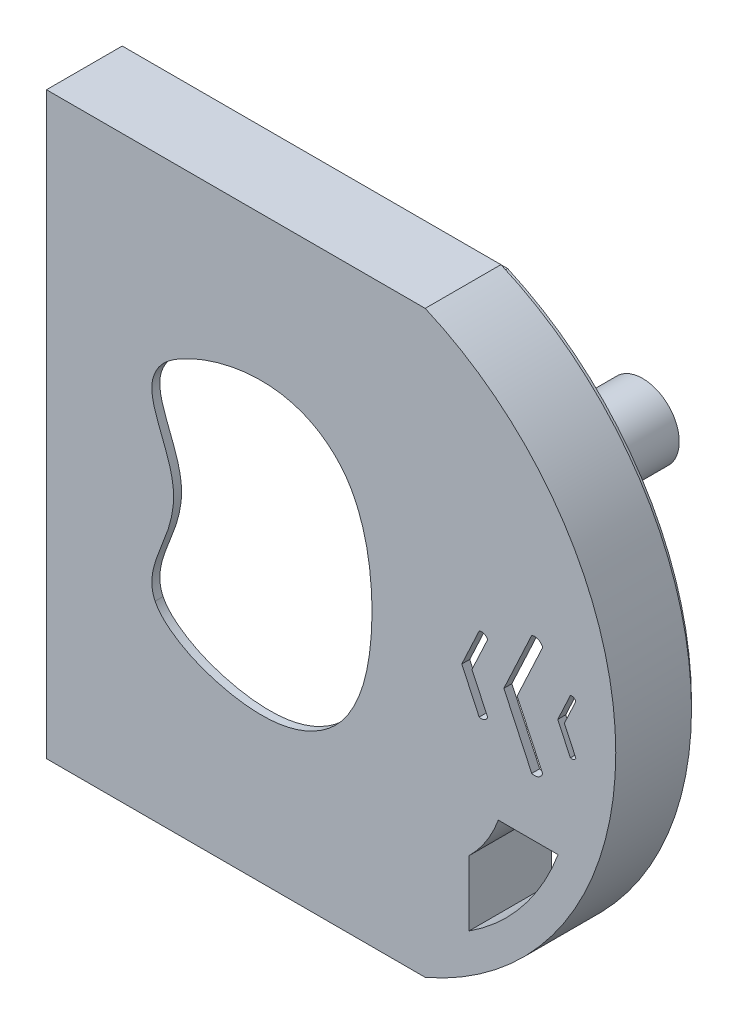
from build123d import *
from build123d.topology import SkipClean

# Parameters (mm, degrees)
BOSS_EXTRUDE1_DEPTH       = 0.5
BOSS_EXTRUDE1_DEPTH_BACK  = 0.0001
SKETCH1_W                 = 25
SKETCH1_H                 = 40
BOSS_EXTRUDE5_DEPTH       = 6.1
BOSS_EXTRUDE5_DEPTH_BACK  = 0.1
CUT_EXTRUDE2_DEPTH        = 5.5
CUT_EXTRUDE2_DEPTH_BACK   = 4
CUT_EXTRUDE3_DEPTH        = 0.5
CUT_EXTRUDE4_DEPTH        = 0.4
SKETCH26_R                = 2.75
SKETCH26_R_2              = 1.25
BOSS_EXTRUDE10_DEPTH      = 10.26724838
CUT_EXTRUDE10_DEPTH       = 12
CUT_EXTRUDE10_DEPTH_BACK  = 8.134
BOSS_EXTRUDE11_DEPTH      = 6.099
BOSS_EXTRUDE11_DEPTH_BACK = 0.1
CUT_EXTRUDE11_DEPTH       = 6.134
CUT_EXTRUDE15_DEPTH       = 45
CUT_EXTRUDE15_DEPTH_BACK  = 1.134
BOSS_EXTRUDE13_DEPTH      = 0.000134
BOSS_EXTRUDE13_DEPTH_BACK = 3
SKETCH40_W                = 2
SKETCH40_H                = 2
CUT_EXTRUDE17_DEPTH       = 0.25
SKETCH43_R                = 0.25
CUT_EXTRUDE19_DEPTH       = 3.25
SKETCH45_W                = 1
SKETCH45_H                = 2
BOSS_EXTRUDE14_DEPTH      = 6.25
CUT_EXTRUDE21_DEPTH       = 2
CUT_EXTRUDE21_DEPTH_BACK  = 4.25
BOSS_EXTRUDE15_DEPTH      = 1.25
BOSS_EXTRUDE15_DEPTH_BACK = 3.25


with BuildPart() as part:
    # Sketch1 → Boss-Extrude1 (new, two sides: drawn at the far end of the back side and taken through both)
    with BuildSketch(Plane.XY.offset(-BOSS_EXTRUDE1_DEPTH_BACK)):
        with Locations((-61.729654626, 25.727532329)):
            Rectangle(SKETCH1_W, SKETCH1_H)
    extrude(amount=BOSS_EXTRUDE1_DEPTH + BOSS_EXTRUDE1_DEPTH_BACK)

    # Sketch2 → Boss-Extrude5 (add, two sides: drawn at the far end of the back side and taken through both)
    with BuildSketch(Plane.XY.offset(-BOSS_EXTRUDE5_DEPTH_BACK)):
        with BuildLine():
            Line((-49.388759409, 47.527532329), (-77.888759409, 47.527532329))
            Line((-77.888759409, 47.527532329), (-77.888759409, 3.927532329))
            Line((-77.888759409, 3.927532329), (-49.388759409, 3.927532329))
            ThreePointArc((-49.388759409, 3.927532329), (-35.047275566, 25.727532329), (-49.388759409, 47.527532329))
        make_face()
    extrude(amount=BOSS_EXTRUDE5_DEPTH + BOSS_EXTRUDE5_DEPTH_BACK)

    # Sketch8 → Cut-Extrude2 (cut, two sides: drawn at the far end of the back side and taken through both)
    with BuildSketch(Plane.XY.offset(-CUT_EXTRUDE2_DEPTH_BACK)):
        with BuildLine():
            Line((-76.888759409, 46.527532329), (-76.888759409, 4.927532329))
            Line((-76.888759409, 4.927532329), (-49.388759409, 4.927532329))
            ThreePointArc((-49.388759409, 4.927532329), (-36.047275566, 25.727532329), (-49.388759409, 46.527532329))
            Line((-49.388759409, 46.527532329), (-76.888759409, 46.527532329))
        make_face()
    extrude(amount=CUT_EXTRUDE2_DEPTH + CUT_EXTRUDE2_DEPTH_BACK, mode=Mode.SUBTRACT)

    # Sketch11 → Cut-Extrude3 (cut)
    with BuildSketch(Plane(origin=(0, 0, -0.1), x_dir=(-1, 0, 0), z_dir=(0, 0, -1))):
        with BuildLine():
            Line((49.388759409, 47.527532329), (77.888759409, 47.527532329))
            Line((77.888759409, 47.527532329), (77.888759409, 3.927532329))
            Line((77.888759409, 3.927532329), (49.388759409, 3.927532329))
            ThreePointArc((49.388759409, 3.927532329), (35.047275566, 25.727532329), (49.388759409, 47.527532329))
        make_face()
        with BuildLine():
            Line((49.388759409, 4.427532329), (77.388759409, 4.427532329))
            Line((77.388759409, 4.427532329), (77.388759409, 47.027532329))
            Line((77.388759409, 47.027532329), (49.388759409, 47.027532329))
            ThreePointArc((49.388759409, 47.027532329), (35.547275566, 25.727532329), (49.388759409, 4.427532329))
        make_face(mode=Mode.SUBTRACT)
    extrude(amount=-CUT_EXTRUDE3_DEPTH, mode=Mode.SUBTRACT)

    # Sketch16 → Cut-Extrude4 (cut)
    with BuildSketch(Plane.ZY.offset(77.888759409)):
        Polygon((3.4, 25.727532329), (3.4, 28.727532329), (-2.6, 25.727532329), (3.4, 22.727532329), align=None)
    extrude(amount=-CUT_EXTRUDE4_DEPTH, mode=Mode.SUBTRACT)

    # Sketch26 → Boss-Extrude10 (add)
    with BuildSketch(Plane(origin=(0, 0, 5.5), x_dir=(-1, 0, 0), z_dir=(0, 0, -1))):
        with Locations((43.888759409, 37.527532329)):
            Circle(SKETCH26_R)
        with Locations((43.888759409, 37.527532329)):
            Circle(SKETCH26_R_2, mode=Mode.SUBTRACT)
    extrude(amount=BOSS_EXTRUDE10_DEPTH)

    # Sketch21 → Cut-Extrude10 (cut, two sides: drawn at the far end of the back side and taken through both)
    with BuildSketch(Plane.XY.offset(-CUT_EXTRUDE10_DEPTH_BACK)):
        with BuildLine():
            Line((-39.388759409, 16.927532329), (-43.888759409, 16.927532329))
            ThreePointArc((-43.888759409, 16.927532329), (-44.802883544, 15.087640192), (-46.102233889, 13.496252529))
            Line((-46.102233889, 13.496252529), (-46.102233889, 8.590508419))
            ThreePointArc((-46.102233889, 8.590508419), (-42.072202095, 12.216842991), (-39.388759409, 16.927532329))
        make_face()
    extrude(amount=CUT_EXTRUDE10_DEPTH + CUT_EXTRUDE10_DEPTH_BACK, mode=Mode.SUBTRACT)

    # Sketch31 → Boss-Extrude11 (add, two sides: drawn at the far end of the back side and taken through both)
    with SkipClean():  # the faces are left unmerged after this step: merging them gives an invalid solid
        with BuildSketch(Plane.XY.offset(-BOSS_EXTRUDE11_DEPTH_BACK)):
            with BuildLine():
                Line((-46.602233889, 13.746252529), (-46.602233889, 7.840508419))
                ThreePointArc((-46.602233889, 7.840508419), (-41.841207095, 11.90170037), (-38.872169608, 17.410372859))
                Line((-38.872169608, 17.410372859), (-44.405349209, 17.410372859))
                ThreePointArc((-44.405349209, 17.410372859), (-45.288328532, 15.449128236), (-46.602233889, 13.746252529))
            make_face()
            with BuildLine():
                Line((-46.102233889, 8.590508419), (-46.102233889, 13.496252529))
                ThreePointArc((-46.102233889, 13.496252529), (-44.802883544, 15.087640192), (-43.888759409, 16.927532329))
                Line((-43.888759409, 16.927532329), (-39.388759409, 16.927532329))
                ThreePointArc((-39.388759409, 16.927532329), (-42.072202095, 12.216842991), (-46.102233889, 8.590508419))
            make_face(mode=Mode.SUBTRACT)
        extrude(amount=BOSS_EXTRUDE11_DEPTH + BOSS_EXTRUDE11_DEPTH_BACK)
    add(part.part.scale(1), mode=Mode.REPLACE)  # the faces are merged on a copy

    # Sketch32 → Cut-Extrude11 (cut)
    with BuildSketch(Plane.XY.offset(6.1)):
        with BuildLine():
            ThreePointArc((-40.549573572, 29.843349948), (-40.880943975, 30.204977286), (-41.370967377, 30.22637217))
            Line((-41.370967377, 30.22637217), (-43.468810847, 25.727532329))
            Line((-43.468810847, 25.727532329), (-41.370967377, 21.228692489))
            ThreePointArc((-41.370967377, 21.228692489), (-40.880943975, 21.250087373), (-40.549573572, 21.611714711))
            Line((-40.549573572, 21.611714711), (-42.468810847, 25.727532329))
            Line((-42.468810847, 25.727532329), (-40.549573572, 29.843349948))
        make_face()
        with BuildLine():
            ThreePointArc((-44.686919093, 28.29425785), (-44.960458349, 28.539533732), (-45.327775477, 28.531652719))
            Line((-45.327775477, 28.531652719), (-46.635358289, 25.727532329))
            Line((-46.635358289, 25.727532329), (-45.327775477, 22.92341194))
            ThreePointArc((-45.327775477, 22.92341194), (-44.945456274, 22.940104356), (-44.686919094, 23.222248178))
            Line((-44.686919094, 23.222248178), (-45.86947757, 25.758253013))
            Line((-45.86947757, 25.758253013), (-44.686919093, 28.29425785))
        make_face()
        with BuildLine():
            Line((-38.463994309, 27.761553521), (-39.412473967, 25.727532329))
            Line((-39.412473967, 25.727532329), (-38.463994307, 23.693511135))
            ThreePointArc((-38.463994307, 23.693511135), (-38.218982607, 23.704208577), (-38.053297405, 23.885022246))
            Line((-38.053297405, 23.885022246), (-38.912473967, 25.727532329))
            Line((-38.912473967, 25.727532329), (-38.053297406, 27.570042411))
            ThreePointArc((-38.053297406, 27.570042411), (-38.218982608, 27.75085608), (-38.463994309, 27.761553521))
        make_face()
    extrude(amount=-CUT_EXTRUDE11_DEPTH, mode=Mode.SUBTRACT)

    # Sketch33 → Cut-Extrude15 (cut, two sides: drawn at the far end of the back side and taken through both)
    with BuildSketch(Plane.XY.offset(-CUT_EXTRUDE15_DEPTH_BACK)):
        with BuildLine():
            add(Edge.make_bspline(
                [(-69.715544941, 18.283161861), (-70.060831971, 19.012218904), (-69.893833059, 20.78213803), (-68.885025404, 22.803797187), (-68.411940584, 24.576549409), (-68.25394968, 26.022031822), (-68.548256015, 27.643980301), (-69.184424754, 29.246015832), (-69.784454695, 30.792385154), (-70.119211475, 32.284154044), (-69.383787507, 34.06827327), (-67.379464284, 35.365690247), (-64.641716712, 36.403803159), (-61.448006845, 36.828238469), (-58.062408155, 36.164047577), (-55.451422294, 34.133156415), (-53.691745736, 30.458555689), (-53.408315733, 27.639817782), (-53.384047918, 25.751284661)],
                knots=[0, 0, 0, 0, 0.056113373, 0.130582993, 0.168191292, 0.193562185, 0.23929808, 0.29015092, 0.322884085, 0.364734021, 0.400905431, 0.460049188, 0.537277144, 0.621512931, 0.698396438, 0.791261461, 0.857327323, 1, 1, 1, 1], degree=3))
            add(Edge.make_bspline(
                [(-53.384047918, 25.751284661), (-53.419757153, 23.771297171), (-53.711559372, 20.635303734), (-55.852462116, 16.857084186), (-59.641637131, 14.56376187), (-64.320520834, 14.870880915), (-67.989729035, 16.375437606), (-69.424834511, 17.694405648), (-69.715544941, 18.283161861)],
                knots=[0, 0, 0, 0, 0.24488022, 0.378469492, 0.51827081, 0.765302127, 0.920676086, 1, 1, 1, 1], degree=3))
        make_face()
    extrude(amount=CUT_EXTRUDE15_DEPTH + CUT_EXTRUDE15_DEPTH_BACK, mode=Mode.SUBTRACT)

    # Sketch39 → Boss-Extrude13 (add, two sides: drawn at the far end of the back side and taken through both)
    with BuildSketch(Plane.ZY.offset(77.888759409).offset(-BOSS_EXTRUDE13_DEPTH_BACK)):
        Polygon((4.25, 35.877532329), (4.25, 36.877532329), (4.25, 37.877532329), (2.25, 37.877532329), (2.25, 35.877532329), align=None)
    extrude(amount=BOSS_EXTRUDE13_DEPTH + BOSS_EXTRUDE13_DEPTH_BACK)

    # Sketch40 → Cut-Extrude17 (cut)
    with BuildSketch(Plane.ZY.offset(77.888893409)):
        with Locations((3.25, 36.877532329)):
            Rectangle(SKETCH40_W, SKETCH40_H)
    extrude(amount=-CUT_EXTRUDE17_DEPTH, mode=Mode.SUBTRACT)

    # Sketch43 → Cut-Extrude19 (cut)
    with BuildSketch(Plane.ZY.offset(77.888759409)):
        with Locations((3.25, 36.877532329)):
            Circle(SKETCH43_R)
    extrude(amount=-CUT_EXTRUDE19_DEPTH, mode=Mode.SUBTRACT)

    # Sketch45 → Boss-Extrude14 (add)
    with BuildSketch(Plane(origin=(0, 0, 2.25), x_dir=(-1, 0, 0), z_dir=(0, 0, -1))):
        with Locations((76.388759409, 36.877532329)):
            Rectangle(SKETCH45_W, SKETCH45_H)
    extrude(amount=BOSS_EXTRUDE14_DEPTH)

    # Sketch51 → Cut-Extrude21 (cut, two sides: drawn at the far end of the back side and taken through both)
    with BuildSketch(Plane(origin=(0, 37.877532329, 0), x_dir=(1, 0, 0), z_dir=(0, 1, 0)).offset(-CUT_EXTRUDE21_DEPTH_BACK)):
        Polygon((-76.888759409, 2.05), (-75.888759409, 4), (-76.888759409, 4), align=None)
    extrude(amount=CUT_EXTRUDE21_DEPTH + CUT_EXTRUDE21_DEPTH_BACK, mode=Mode.SUBTRACT)

    # Sketch52 → Boss-Extrude15 (add, two sides: drawn at the far end of the back side and taken through both)
    with BuildSketch(Plane(origin=(0, 37.877532329, 0), x_dir=(1, 0, 0), z_dir=(0, 1, 0)).offset(-BOSS_EXTRUDE15_DEPTH_BACK)):
        Polygon((-75.688759409, 2.05), (-75.488759409, 2.05), (-75.888759409, 4), (-76.888759409, 2.05), (-76.888759409, 0.1), (-76.888759409, -4.25), (-74.888759409, -4.25), (-74.888759409, -2.25), (-75.888759409, -2.25), (-75.888759409, 3.025), align=None)
    extrude(amount=BOSS_EXTRUDE15_DEPTH + BOSS_EXTRUDE15_DEPTH_BACK)


solid = part.part
